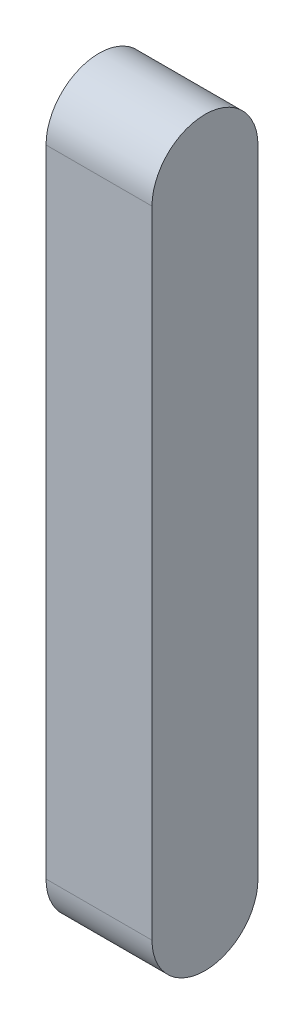
from build123d import *

# Parameters (mm, degrees)
SKETCH_1_R      = 5
SKETCH_1_W      = 10
SKETCH_1_H      = 60
EXTRUDE_1_DEPTH = 10


with BuildPart() as part:
    # 草图1 → 凸台-拉伸1 (new body)
    with BuildSketch(Plane(origin=(0, 0, 0), x_dir=(0, 0, -1), z_dir=(1, 0, 0))):
        with Locations((0, 30)):
            Circle(SKETCH_1_R)
        with Locations((0, -30)):
            Circle(SKETCH_1_R)
        Rectangle(SKETCH_1_W, SKETCH_1_H)
    extrude(amount=EXTRUDE_1_DEPTH)


solid = part.part
